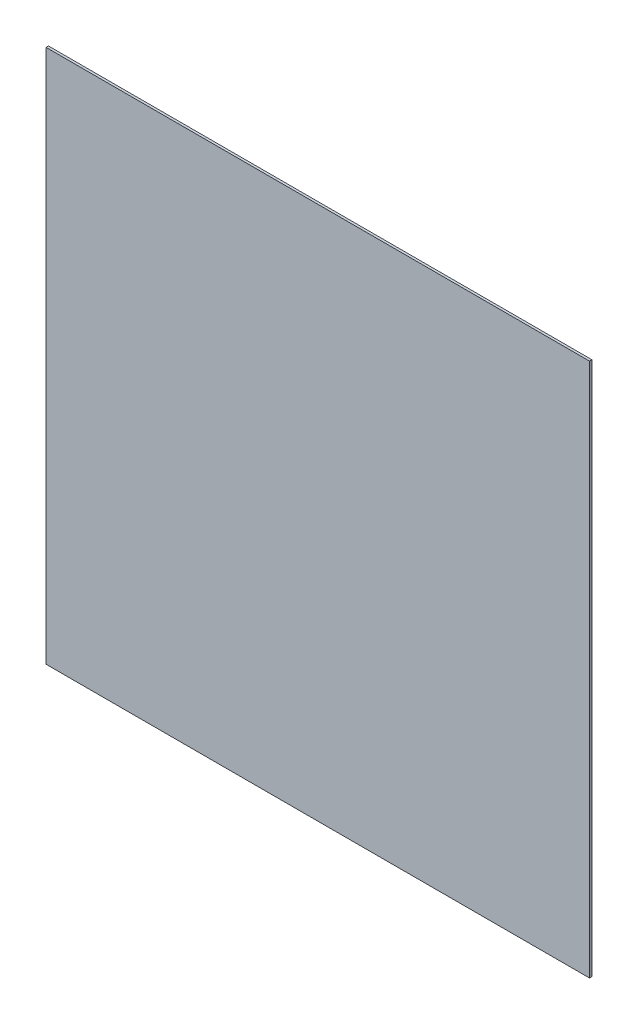
from build123d import *

# Parameters (mm, degrees)
SKETCH1_W           = 720
SKETCH1_H           = 708
BOSS_EXTRUDE1_DEPTH = 3.175


with BuildPart() as part:
    # Sketch1 → Boss-Extrude1 (new body)
    with BuildSketch(Plane.XY):
        Rectangle(SKETCH1_W, SKETCH1_H)
    extrude(amount=BOSS_EXTRUDE1_DEPTH)


solid = part.part
